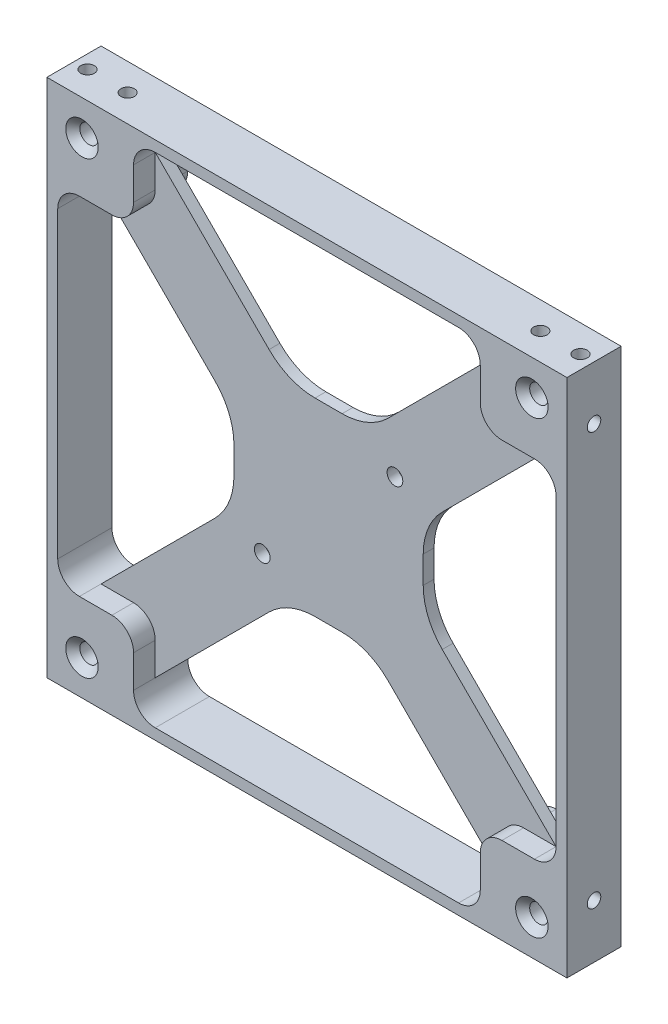
from build123d import *

# Parameters (mm, degrees)
BOTTOMLAYER_DEPTH              = 4
MIDDLELAYER_DEPTH              = 2
FILLUPLAYER_START              = -2
FILLUPLAYER_DEPTH              = 2
TOPLAYER_DEPTH                 = 4
M3_CLEARANCE_HOLE1_D           = 3.4
M3_CLEARANCE_HOLE1_CSINK_D     = 6
M3_CLEARANCE_HOLE1_CSINK_ANGLE = 90
M2_5_CLEARANCE_HOLE1_D         = 2.9
CIRPATTERN1_COUNT              = 4


with BuildPart() as part:
    # Sketch3 → BottomLayer (new body)
    with BuildSketch(Plane.XY):
        with BuildLine():
            Line((0, 48), (48, 48))
            Line((48, 48), (48, 0))
            Line((48, 0), (46, 0))
            Line((46, 0), (46, 28))
            ThreePointArc((46, 28), (44.828427125, 30.828427125), (42, 32))
            Line((42, 32), (36, 32))
            ThreePointArc((36, 32), (33.171572875, 33.171572875), (32, 36))
            Line((32, 36), (32, 42))
            ThreePointArc((32, 42), (30.828427125, 44.828427125), (28, 46))
            Line((28, 46), (0, 46))
            Line((0, 46), (0, 48))
        make_face()
    bottomlayer = extrude(amount=BOTTOMLAYER_DEPTH)

    # Sketch6 → MiddleLayer (add)
    with BuildSketch(Plane.XY.offset(4)):
        with BuildLine():
            Line((0, 17.470562748), (0, 0))
            Line((0, 0), (17.470562748, 0))
            Line((17.470562748, 0), (17.470562748, 2.5))
            ThreePointArc((17.470562748, 2.5), (18.384008358, 7.092201188), (20.985281374, 10.985281374))
            Line((20.985281374, 10.985281374), (48, 38))
            Line((48, 38), (48, 48))
            Line((48, 48), (38, 48))
            Line((38, 48), (10.985281374, 20.985281374))
            ThreePointArc((10.985281374, 20.985281374), (7.092201188, 18.384008358), (2.5, 17.470562748))
            Line((2.5, 17.470562748), (0, 17.470562748))
        make_face()
    middlelayer = extrude(amount=MIDDLELAYER_DEPTH)

    # Sketch10 → FillUpLayer (add)
    with BuildSketch(Plane.XY.offset(6).offset(FILLUPLAYER_START)):
        with BuildLine():
            Line((48, 48), (0, 48))
            Line((0, 48), (0, 46))
            Line((0, 46), (28, 46))
            ThreePointArc((28, 46), (30.828427125, 44.828427125), (32, 42))
            Line((32, 42), (32, 36))
            ThreePointArc((32, 36), (33.171572875, 33.171572875), (36, 32))
            Line((36, 32), (42, 32))
            ThreePointArc((42, 32), (44.828427125, 30.828427125), (46, 28))
            Line((46, 28), (46, 0))
            Line((46, 0), (48, 0))
            Line((48, 0), (48, 48))
        make_face()
    filluplayer = extrude(amount=FILLUPLAYER_DEPTH)

    # Sketch11 → TopLayer (add)
    with BuildSketch(Plane.XY.offset(6)):
        with BuildLine():
            Line((48, 48), (0, 48))
            Line((0, 48), (0, 46))
            Line((0, 46), (28, 46))
            ThreePointArc((28, 46), (30.828427125, 44.828427125), (32, 42))
            Line((32, 42), (32, 36))
            ThreePointArc((32, 36), (33.171572875, 33.171572875), (36, 32))
            Line((36, 32), (42, 32))
            ThreePointArc((42, 32), (44.828427125, 30.828427125), (46, 28))
            Line((46, 28), (46, 0))
            Line((46, 0), (48, 0))
            Line((48, 0), (48, 48))
        make_face()
    toplayer = extrude(amount=TOPLAYER_DEPTH)

    # M3 Clearance Hole1 (through all)
    with Locations(Plane.XY.offset(10)):
        with Locations((41.525, 41.525)):
            m3_clearance_hole1 = CounterSinkHole(M3_CLEARANCE_HOLE1_D / 2, M3_CLEARANCE_HOLE1_CSINK_D / 2, counter_sink_angle=M3_CLEARANCE_HOLE1_CSINK_ANGLE)

    # M2.5 Clearance Hole1 (through all)
    with Locations(Plane.XY.offset(6)):
        with Locations((12.25, 12.25)):
            m2_5_clearance_hole1 = Hole(M2_5_CLEARANCE_HOLE1_D / 2)

    # CirPattern1: BottomLayer, MiddleLayer, FillUpLayer, TopLayer, M3 Clearance Hole1 ×4 about axis
    cirpattern1_axis = Axis((0, 0, -0.5), (0, 0, 1))
    add([bottomlayer.rotate(cirpattern1_axis, i * 360 / CIRPATTERN1_COUNT) for i in range(1, CIRPATTERN1_COUNT)])
    add([middlelayer.rotate(cirpattern1_axis, i * 360 / CIRPATTERN1_COUNT) for i in range(1, CIRPATTERN1_COUNT)])
    add([filluplayer.rotate(cirpattern1_axis, i * 360 / CIRPATTERN1_COUNT) for i in range(1, CIRPATTERN1_COUNT)])
    add([toplayer.rotate(cirpattern1_axis, i * 360 / CIRPATTERN1_COUNT) for i in range(1, CIRPATTERN1_COUNT)])
    add([m3_clearance_hole1.rotate(cirpattern1_axis, i * 360 / CIRPATTERN1_COUNT) for i in range(1, CIRPATTERN1_COUNT)], mode=Mode.SUBTRACT)

    # Sketch21 → Tap Drill M3 Side Plate (revolve, cut)
    with BuildSketch(Plane(origin=(48, 38.1, 5), x_dir=(0, 0, -1), z_dir=(0, 1, 0))):
        Polygon((0, 0), (0, 5.751075774), (1.25, 5), (1.25, 0), align=None)
    tap_drill_m3_side_plate = revolve(axis=Axis((54.35, 38.1, 5), (-1, 0, 0)), mode=Mode.SUBTRACT)

    # Camera Holes: M2.5 Clearance Hole1 across plane
    add(m2_5_clearance_hole1.mirror(Plane(origin=(0, 0, 0), x_dir=(0, 0, 1), z_dir=(-0.7071067811865476, -0.7071067811865476, 0))), mode=Mode.SUBTRACT)

    # Sketch27 → Tap Drill M3 Side Plate 2 (revolve, cut)
    with BuildSketch(Plane(origin=(38.1, 48, 5), x_dir=(0, 0, 1), z_dir=(1, 0, 0))):
        Polygon((0, 0), (0, 5.751075774), (1.25, 5), (1.25, 0), align=None)
    tap_drill_m3_side_plate_2 = revolve(axis=Axis((38.1, 54.35, 5), (0, -1, 0)), mode=Mode.SUBTRACT)

    # Sketch29 → Tap Drill M3 Rail (revolve, cut)
    with BuildSketch(Plane(origin=(45.5, 48, 5), x_dir=(0, 0, 1), z_dir=(1, 0, 0))):
        Polygon((0, 0), (0, 5.751075774), (1.25, 5), (1.25, 0), align=None)
    tap_drill_m3_rail = revolve(axis=Axis((45.5, 54.35, 5), (0, -1, 0)), mode=Mode.SUBTRACT)

    # SidePlate and Rail Holes 1: Tap Drill M3 Side Plate, Tap Drill M3 Side Plate 2, Tap Drill M3 Rail across plane
    add(tap_drill_m3_side_plate.mirror(Plane(origin=(0, 0, 0), x_dir=(0, 0, 1), z_dir=(1, 0, 0))), mode=Mode.SUBTRACT)
    add(tap_drill_m3_side_plate_2.mirror(Plane(origin=(0, 0, 0), x_dir=(0, 0, 1), z_dir=(1, 0, 0))), mode=Mode.SUBTRACT)
    add(tap_drill_m3_rail.mirror(Plane(origin=(0, 0, 0), x_dir=(0, 0, 1), z_dir=(1, 0, 0))), mode=Mode.SUBTRACT)

    # Side Plate and Rail Holes 2 copy 1 sketc → Side Plate and Rail Holes 2 copy 1 (revolve, cut)
    with BuildSketch(Plane(origin=(-48, -38.1, 5), x_dir=(0, 0, -1), z_dir=(0, -1, 0))):
        Polygon((0, 0), (0, 5.751075774), (1.25, 5), (1.25, 0), align=None)
    revolve(axis=Axis((-54.35, -38.1, 5), (1, 0, 0)), mode=Mode.SUBTRACT)

    # Side Plate and Rail Holes 2 copy 2 sketc → Side Plate and Rail Holes 2 copy 2 (revolve, cut)
    with BuildSketch(Plane(origin=(-38.1, -48, 5), x_dir=(0, 0, 1), z_dir=(-1, 0, 0))):
        Polygon((0, 0), (0, 5.751075774), (1.25, 5), (1.25, 0), align=None)
    revolve(axis=Axis((-38.1, -54.35, 5), (0, 1, 0)), mode=Mode.SUBTRACT)

    # Side Plate and Rail Holes 2 copy 3 sketc → Side Plate and Rail Holes 2 copy 3 (revolve, cut)
    with BuildSketch(Plane(origin=(-45.5, -48, 5), x_dir=(0, 0, 1), z_dir=(-1, 0, 0))):
        Polygon((0, 0), (0, 5.751075774), (1.25, 5), (1.25, 0), align=None)
    revolve(axis=Axis((-45.5, -54.35, 5), (0, 1, 0)), mode=Mode.SUBTRACT)

    # Side Plate and Rail Holes 2 copy 4 sketc → Side Plate and Rail Holes 2 copy 4 (revolve, cut)
    with BuildSketch(Plane(origin=(48, -38.1, 5), x_dir=(0, 0, -1), z_dir=(0, -1, 0))):
        Polygon((0, 0), (0, -5.751075774), (1.25, -5), (1.25, 0), align=None)
    revolve(axis=Axis((54.35, -38.1, 5), (1, 0, 0)), mode=Mode.SUBTRACT)

    # Side Plate and Rail Holes 2 copy 5 sketc → Side Plate and Rail Holes 2 copy 5 (revolve, cut)
    with BuildSketch(Plane(origin=(38.1, -48, 5), x_dir=(0, 0, 1), z_dir=(1, 0, 0))):
        Polygon((0, 0), (0, -5.751075774), (1.25, -5), (1.25, 0), align=None)
    revolve(axis=Axis((38.1, -54.35, 5), (0, -1, 0)), mode=Mode.SUBTRACT)

    # Side Plate and Rail Holes 2 copy 6 sketc → Side Plate and Rail Holes 2 copy 6 (revolve, cut)
    with BuildSketch(Plane(origin=(45.5, -48, 5), x_dir=(0, 0, 1), z_dir=(1, 0, 0))):
        Polygon((0, 0), (0, -5.751075774), (1.25, -5), (1.25, 0), align=None)
    revolve(axis=Axis((45.5, -54.35, 5), (0, -1, 0)), mode=Mode.SUBTRACT)


solid = part.part
